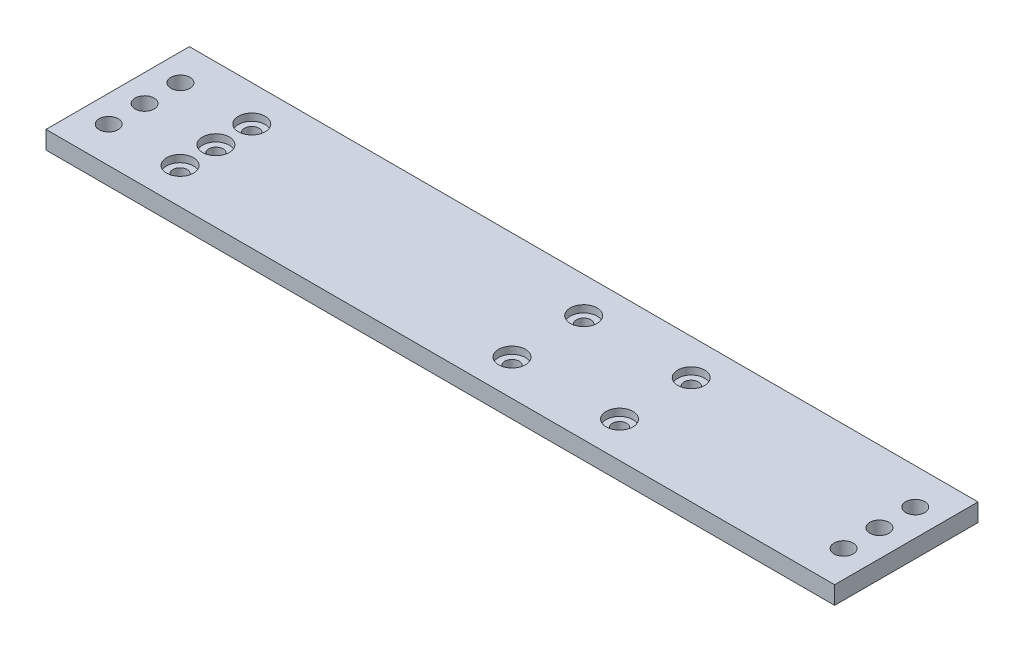
from build123d import *

# Parameters (mm, degrees)
SKETCH1_W                                       = 279.4
SKETCH1_H                                       = 50.8
BOSS_EXTRUDE1_DEPTH                             = 6.35
CBORE_FOR_10_SOCKET_HEAD_CAP_SCREW1_D           = 5.1054
CBORE_FOR_10_SOCKET_HEAD_CAP_SCREW1_CBORE_D     = 9.525
CBORE_FOR_10_SOCKET_HEAD_CAP_SCREW1_CBORE_DEPTH = 2.54
F_1_4_CLEARANCE_HOLE1_D                         = 6.7564


with BuildPart() as part:
    # Sketch1 → Boss-Extrude1 (new body)
    with BuildSketch(Plane(origin=(0, 0, 0), x_dir=(1, 0, 0), z_dir=(0, 1, 0))):
        Rectangle(SKETCH1_W, SKETCH1_H)
    extrude(amount=BOSS_EXTRUDE1_DEPTH)

    # CBORE for #10 Socket Head Cap Screw1 (through all)
    with Locations(Plane(origin=(0, 6.35, 0), x_dir=(1, 0, 0), z_dir=(0, 1, 0))):
        with Locations((50.8, 12.7), (12.7, 12.7), (12.7, -12.7), (50.8, -12.7), (-104.902, 12.7), (-104.902, 0), (-104.902, -12.7)):
            CounterBoreHole(CBORE_FOR_10_SOCKET_HEAD_CAP_SCREW1_D / 2, CBORE_FOR_10_SOCKET_HEAD_CAP_SCREW1_CBORE_D / 2, CBORE_FOR_10_SOCKET_HEAD_CAP_SCREW1_CBORE_DEPTH)

    # 1/4 Clearance Hole1 (through all)
    with Locations(Plane.XZ):
        with Locations((-130.175, 12.7), (-130.175, 0), (-130.175, -12.7), (130.175, 12.7), (130.175, 0), (130.175, -12.7)):
            Hole(F_1_4_CLEARANCE_HOLE1_D / 2)


solid = part.part
